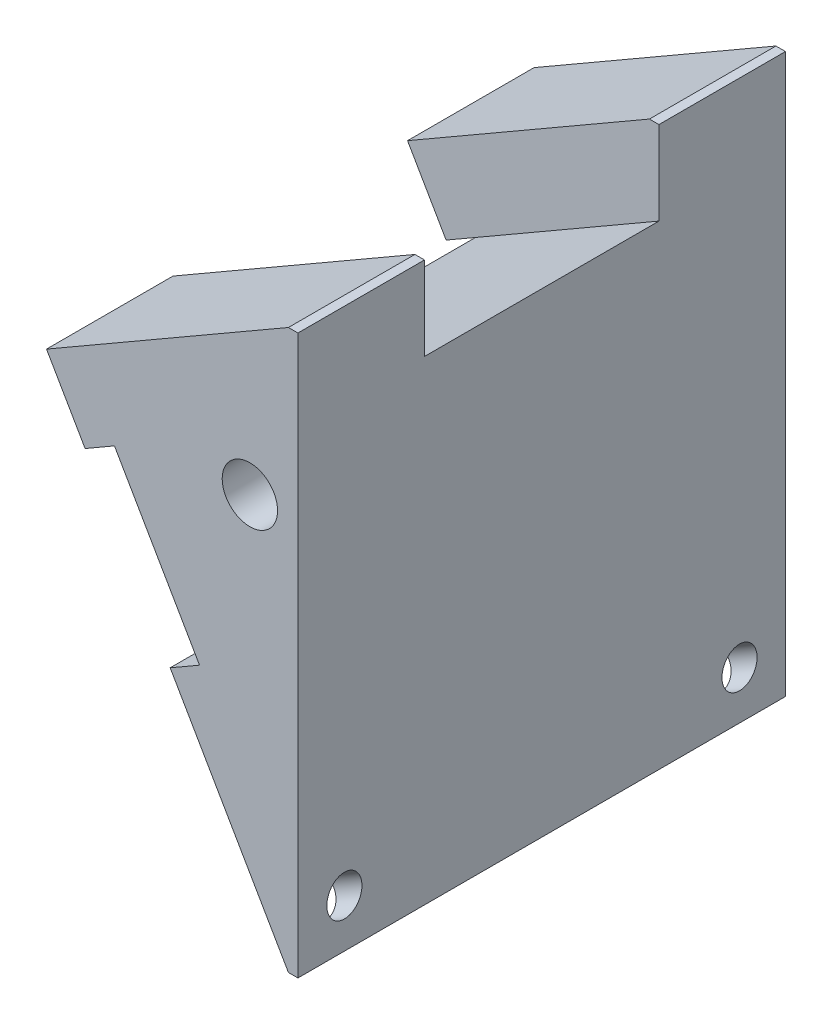
from build123d import *
from OCP.BRepAlgoAPI import BRepAlgoAPI_Cut
from OCP.TopTools import TopTools_ListOfShape

# Parameters (mm, degrees)
BOSS_EXTRUDE1_DEPTH      = 11.938
BOSS_EXTRUDE1_DEPTH_BACK = 18.12511
SKETCH1_W                = 6.216067572
SKETCH1_H                = 27.404994669
BOSS_EXTRUDE2_DEPTH      = 27.404995
CUT_EXTRUDE1_DEPTH       = 4.179688
SKETCH4_R                = 0.95
CUT_EXTRUDE2_DEPTH       = 6.604
SKETCH7_W                = 5.699381266
SKETCH7_H                = 30.253154106
CUT_EXTRUDE3_DEPTH       = 31.242
SKETCH8_R                = 1.5
CUT_EXTRUDE4_DEPTH       = 32.004
SKETCH9_W                = 0.5
SKETCH9_H                = 26.458343153
CUT_EXTRUDE5_DEPTH       = 20


with BuildPart() as part:
    # Sketch1 → Boss-Extrude1 (new, two sides: drawn at the far end of the back side and taken through both)
    with BuildSketch(Plane(origin=(0, 0, 0), x_dir=(1, 0, 0), z_dir=(0, 1, 0)).offset(-BOSS_EXTRUDE1_DEPTH_BACK)):
        with Locations((-0.12984965, -1.559314439)):
            Rectangle(SKETCH1_W, SKETCH1_H)
    extrude(amount=BOSS_EXTRUDE1_DEPTH + BOSS_EXTRUDE1_DEPTH_BACK)

    # Sketch2 → Boss-Extrude2 (add)
    with BuildSketch(Plane(origin=(0, 0, -12.143182896), x_dir=(-1, 0, 0), z_dir=(0, 0, -1))):
        Polygon((15.337816326, 5.142144986), (3.237883436, 12.128044498), (-2.978184136, 12.128044498), (-2.978184136, 11.938), (3.237883436, 11.938), (3.237883436, -18.125109608), (9.640760589, -7.035001064), (8.050552579, -6.116894042), (8.197675426, -5.862069796), (12.657832776, 1.863149344), (14.248040785, 0.945042321), (15.067883436, 2.365051446), (16.337883436, 4.564755971), align=None)
    extrude(amount=-BOSS_EXTRUDE2_DEPTH)

    # Sketch3 → Cut-Extrude1 (cut)
    with BuildSketch(Plane(origin=(-6.061068176, 10.498078028, 0), x_dir=(0.866025403784441, 0.49999999999999606, 0), z_dir=(-0.49999999999999606, 0.866025403784441, 0))):
        Polygon((-11.866644114, -1.559314438), (-11.866644114, -7.909314438), (3.259932939, -7.909314438), (8.643205368, -7.909314438), (8.643205368, 4.790685562), (3.259932939, 4.790685562), (-11.866644114, 4.790685562), align=None)
    extrude(amount=-CUT_EXTRUDE1_DEPTH, mode=Mode.SUBTRACT)

    # Sketch4 → Cut-Extrude2 (cut)
    with BuildSketch(Plane(origin=(-10.27681526, -5.933322057, 0), x_dir=(0, 0, 1), z_dir=(-0.8660254037844423, -0.49999999999999406, 0))):
        with Locations(Location((12.245811773, 10.122136351, 0), (0, 0, 270))):
            Circle(SKETCH4_R)
        with Locations(Location((-9.154188227, 10.122136351, 0), (0, 0, 270))):
            Circle(SKETCH4_R)
        with Locations(Location((-9.154188227, -12.077863649, 0), (0, 0, 270))):
            Circle(SKETCH4_R)
        with Locations(Location((12.245811773, -12.077863649, 0), (0, 0, 270))):
            Circle(SKETCH4_R)
    extrude(amount=-CUT_EXTRUDE2_DEPTH, mode=Mode.SUBTRACT)


with BuildPart() as cut_extrude3_tool:
    # Sketch7 → Cut-Extrude3 (new body)
    with BuildSketch(Plane(origin=(0, 0, -12.143182896), x_dir=(-1, 0, 0), z_dir=(0, 0, -1))):
        with Locations((-0.128493503, -2.998532555)):
            Rectangle(SKETCH7_W, SKETCH7_H)
    extrude(amount=-CUT_EXTRUDE3_DEPTH)


with BuildPart() as part_1:
    add(part.part)

    # Cut-Extrude3: cut by cut_extrude3_tool, with a tolerance
    cut_extrude3_stock = TopTools_ListOfShape()
    cut_extrude3_stock.Append(part_1.part.wrapped)
    cut_extrude3_tools = TopTools_ListOfShape()
    cut_extrude3_tools.Append(cut_extrude3_tool.part.wrapped)
    cut_extrude3_cut = BRepAlgoAPI_Cut()
    cut_extrude3_cut.SetArguments(cut_extrude3_stock)
    cut_extrude3_cut.SetTools(cut_extrude3_tools)
    cut_extrude3_cut.SetFuzzyValue(0.00001)
    cut_extrude3_cut.Build()
    add(Compound.cast(cut_extrude3_cut.Shape()).solids(), mode=Mode.REPLACE)

    # Sketch8 → Cut-Extrude4 (cut)
    with BuildSketch(Plane(origin=(0, 0, -12.143182896), x_dir=(-1, 0, 0), z_dir=(0, 0, -1))):
        with Locations((5.32419713, 3.241176343)):
            Circle(SKETCH8_R)
    extrude(amount=-CUT_EXTRUDE4_DEPTH, mode=Mode.SUBTRACT)

    # Sketch9 → Cut-Extrude5 (cut)
    with BuildSketch(Plane(origin=(-10.27681526, -5.933322057, 0), x_dir=(0, 0, 1), z_dir=(-0.8660254037844423, -0.49999999999999406, 0))):
        with Locations((-11.893182896, -1.107035226)):
            Rectangle(SKETCH9_W, SKETCH9_H)
        with Locations((15.011811773, -1.107035226)):
            Rectangle(SKETCH9_W, SKETCH9_H)
    extrude(amount=-CUT_EXTRUDE5_DEPTH, mode=Mode.SUBTRACT)


solid = part_1.part
